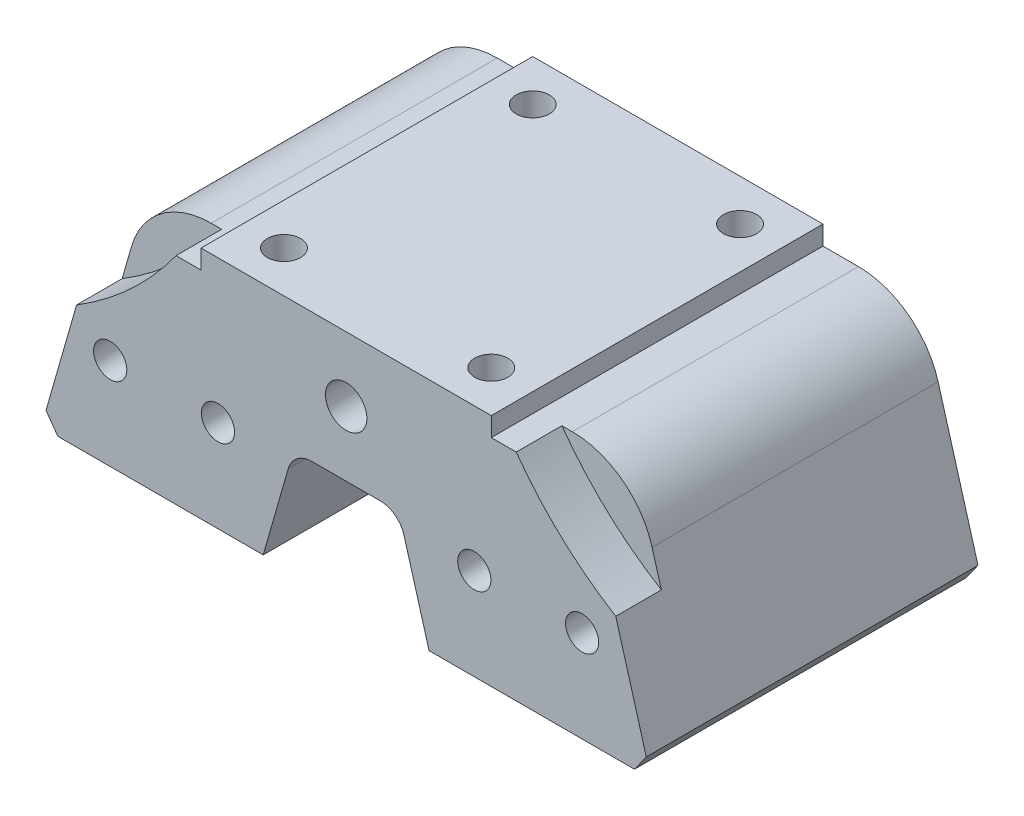
from build123d import *
from build123d.topology import SkipClean

# Parameters (mm, degrees)
SKETCH_1_R              = 2.4
SKETCH_1_R_2            = 6.5
EXTRUDE_1_DEPTH         = 40
FILLET_1_R              = 10
SKETCH_2_R              = 2.4
CUT_EXTRUDE_1_DEPTH     = 66.0828238
SKETCH_4_R              = 41.2
CUT_EXTRUDE_2_DEPTH     = 5.5
CUT_EXTRUDE_3_DEPTH     = 64.25167155
SKETCH_6_W              = 35.436929204
SKETCH_6_H              = 26
EXTRUDE_2_DEPTH         = 40
CUT_EXTRUDE_4_DEPTH     = 42
EXTRUDE_START           = -40
EXTRUDE_3_DEPTH         = 40
SKETCH_9_R              = 2
CUT_EXTRUDE_5_DEPTH     = 42
SKETCH_13_R             = 2
CUT_EXTRUDE_6_DEPTH     = 10
SKETCH_14_R             = 2
EXTRUDE_4_DEPTH         = 40
EXTRUDE_START_2         = 2.3
SKETCH_15_W             = 35
SKETCH_15_H             = 40
SKETCH_15_R             = 2
EXTRUDE_5_DEPTH         = 2.3
SKETCH_16_R             = 2.5
CUT_EXTRUDE_7_DEPTH     = 62.3
CUT_EXTRUDE_START       = -26
CUT_EXTRUDE_8_OUTLINE_R = 2
CUT_EXTRUDE_8_DEPTH     = 19.5


# Read off the part's stored shape, not the designer's step: 切除-拉伸8
with BuildPart() as part:
    # 草图1 → 凸台-拉伸1 (new body)
    with BuildSketch(Plane.XY):
        Polygon((-29.269334238, -5), (44.269334238, -5), (36.813954208, 21), (-21.813954208, 21), align=None)
        with Locations((15, 17)):
            Circle(SKETCH_1_R, mode=Mode.SUBTRACT)
        with Locations((15, 0)):
            Circle(SKETCH_1_R, mode=Mode.SUBTRACT)
        Circle(SKETCH_1_R, mode=Mode.SUBTRACT)
        with Locations((0, 17)):
            Circle(SKETCH_1_R, mode=Mode.SUBTRACT)
        with Locations((7.5, 8)):
            Circle(SKETCH_1_R_2, mode=Mode.SUBTRACT)
    extrude(amount=EXTRUDE_1_DEPTH)

    # 圆角1
    fillet_1_edges = [part.edges().sort_by_distance(p)[0] for p in [
        (-21.813954208, 21, 20),
        (36.813954208, 21, 20),
    ]]
    fillet(fillet_1_edges, radius=FILLET_1_R)

    # 草图2 → 切除-拉伸1 (cut, through all)
    with BuildSketch(Plane(origin=(0, 21, 0), x_dir=(1, 0, 0), z_dir=(0, 1, 0))):
        with Locations(Location((-5, -5, 0), (0, 0, 180))):
            Circle(SKETCH_2_R)
        with Locations(Location((20, -5, 0), (0, 0, 180))):
            Circle(SKETCH_2_R)
        with Locations(Location((-5, -35, 0), (0, 0, 180))):
            Circle(SKETCH_2_R)
        with Locations(Location((20, -35, 0), (0, 0, 180))):
            Circle(SKETCH_2_R)
    extrude(amount=-CUT_EXTRUDE_1_DEPTH, mode=Mode.SUBTRACT)

    # 草图4 → 切除-拉伸2 (cut)
    with BuildSketch(Plane.XY.offset(40)):
        with Locations((-46.5, 45)):
            Circle(SKETCH_4_R)
        with Locations((61.5, 45)):
            Circle(SKETCH_4_R)
    extrude(amount=-CUT_EXTRUDE_2_DEPTH, mode=Mode.SUBTRACT)

    # 草图5 → 切除-拉伸3 (cut, through all)
    with BuildSketch(Plane(origin=(0, 0, 0), x_dir=(-1, 0, 0), z_dir=(0, 0, -1))):
        Polygon((-42.269334238, -5), (-44.269334238, -5), (-43.695843466, -3), align=None)
        Polygon((28.695843466, -3), (27.269334238, -5), (29.269334238, -5), align=None)
    extrude(amount=-CUT_EXTRUDE_3_DEPTH, mode=Mode.SUBTRACT)

    # 草图6 → 凸台-拉伸2 (add)
    with BuildSketch(Plane.XY.offset(40)):
        with Locations((7.60959875, 8)):
            Rectangle(SKETCH_6_W, SKETCH_6_H)
    extrude(amount=-EXTRUDE_2_DEPTH)

    # 草图7 → 切除-拉伸4 (cut)
    with BuildSketch(Plane.XY.offset(40)):
        with BuildLine():
            Line((-22.507387905, -5), (37.507387905, -5))
            Line((37.507387905, -5), (35.643542897, 1.5))
            Line((35.643542897, 1.5), (34.432453611, 5.723570268))
            Line((34.432453611, 5.723570268), (33.76369363, 8.055813487))
            Line((33.76369363, 8.055813487), (32.642829643, 11.964730745))
            ThreePointArc((32.642829643, 11.964730745), (31.384766288, 13.795224285), (29.278413707, 14.5))
            Line((29.278413707, 14.5), (28.012091734, 14.5))
            Line((28.012091734, 14.5), (24.82521302, 14.5))
            Line((24.82521302, 14.5), (-9.82521302, 14.5))
            Line((-9.82521302, 14.5), (-13.012091734, 14.5))
            Line((-13.012091734, 14.5), (-14.278413707, 14.5))
            ThreePointArc((-14.278413707, 14.5), (-16.384766288, 13.795224285), (-17.642829643, 11.964730745))
            Line((-17.642829643, 11.964730745), (-18.76369363, 8.055813487))
            Line((-18.76369363, 8.055813487), (-19.432453611, 5.723570268))
            Line((-19.432453611, 5.723570268), (-20.643542897, 1.5))
            Line((-20.643542897, 1.5), (-22.507387905, -5))
        make_face()
    extrude(amount=-CUT_EXTRUDE_4_DEPTH, mode=Mode.SUBTRACT)

    # 草图8 → 凸台-拉伸3 (add)
    with BuildSketch(Plane(origin=(0, 0, 0), x_dir=(-1, 0, 0), z_dir=(0, 0, -1)).offset(EXTRUDE_START)):
        with BuildLine():
            Line((-32.642829643, 11.964730745), (-36.218494875, -0.505095833))
            ThreePointArc((-36.218494875, -0.505095833), (-31.672508019, 1.693488789), (-29.830249532, 6.395175135))
            ThreePointArc((-29.830249532, 6.395175135), (-30.573281352, 9.514892934), (-32.642829643, 11.964730745))
        make_face()
        with BuildLine():
            ThreePointArc((17.642829643, 11.964730745), (15.098349227, 4.487546685), (21.218494875, -0.505095833))
            Line((21.218494875, -0.505095833), (17.642829643, 11.964730745))
        make_face()
    extrude(amount=EXTRUDE_3_DEPTH)

    # 草图9 → 切除-拉伸5 (cut)
    with BuildSketch(Plane(origin=(0, 0, 0), x_dir=(-1, 0, 0), z_dir=(0, 0, -1))):
        with Locations((-35.953320593, 6.086964229)):
            Circle(SKETCH_9_R)
        with Locations((20.953320593, 6.086964229)):
            Circle(SKETCH_9_R)
    extrude(amount=-CUT_EXTRUDE_5_DEPTH, mode=Mode.SUBTRACT)

    # 草图13 → 切除-拉伸6 (cut)
    with BuildSketch(Plane(origin=(0, 21, 0), x_dir=(1, 0, 0), z_dir=(0, 1, 0))):
        with Locations(Location((20, -35, 0), (0, 0, 180))):
            Circle(SKETCH_13_R)
        with Locations(Location((-5, -35, 0), (0, 0, 180))):
            Circle(SKETCH_13_R)
        with Locations(Location((-5, -5, 0), (0, 0, 180))):
            Circle(SKETCH_13_R)
        with Locations(Location((20, -5, 0), (0, 0, 180))):
            Circle(SKETCH_13_R)
    extrude(amount=-CUT_EXTRUDE_6_DEPTH, mode=Mode.SUBTRACT)

    # 草图14 → 凸台-拉伸4 (add)
    with BuildSketch(Plane(origin=(0, 0, 0), x_dir=(-1, 0, 0), z_dir=(0, 0, -1)).offset(EXTRUDE_START)):
        with BuildLine():
            Line((-36.218494875, -0.505095833), (-37.507387905, -5))
            Line((-37.507387905, -5), (-17.5, -5))
            Line((-17.5, -5), (-14.481456538, 5.526912067))
            ThreePointArc((-14.481456538, 5.526912067), (-13.40311652, 7.09590653), (-11.597671451, 7.7))
            Line((-11.597671451, 7.7), (-7.5, 7.7))
            Line((-7.5, 7.7), (-3.402328549, 7.7))
            ThreePointArc((-3.402328549, 7.7), (-1.59688348, 7.09590653), (-0.518543462, 5.526912067))
            Line((-0.518543462, 5.526912067), (2.5, -5))
            Line((2.5, -5), (22.507387905, -5))
            Line((22.507387905, -5), (21.218494875, -0.505095833))
            ThreePointArc((21.218494875, -0.505095833), (15.098349227, 4.487546685), (17.642829643, 11.964730745))
            ThreePointArc((17.642829643, 11.964730745), (16.384766288, 13.795224285), (14.278413707, 14.5))
            Line((14.278413707, 14.5), (-29.278413707, 14.5))
            ThreePointArc((-29.278413707, 14.5), (-31.384766288, 13.795224285), (-32.642829643, 11.964730745))
            ThreePointArc((-32.642829643, 11.964730745), (-30.098349227, 4.487546685), (-36.218494875, -0.505095833))
        make_face()
        with Locations((-22.953320593, 6.086964229)):
            Circle(SKETCH_14_R, mode=Mode.SUBTRACT)
        with Locations((7.953320593, 6.086964229)):
            Circle(SKETCH_14_R, mode=Mode.SUBTRACT)
    extrude(amount=EXTRUDE_4_DEPTH)

    # 草图15 → 凸台-拉伸5 (add)
    with BuildSketch(Plane(origin=(0, 21, 0), x_dir=(1, 0, 0), z_dir=(0, 1, 0)).offset(EXTRUDE_START_2)):
        with Locations((7.5, -20)):
            Rectangle(SKETCH_15_W, SKETCH_15_H)
        with Locations(Location((-5, -35, 0), (0, 0, 180))):
            Circle(SKETCH_15_R, mode=Mode.SUBTRACT)
        with Locations(Location((20, -35, 0), (0, 0, 180))):
            Circle(SKETCH_15_R, mode=Mode.SUBTRACT)
        with Locations(Location((-5, -5, 0), (0, 0, 180))):
            Circle(SKETCH_15_R, mode=Mode.SUBTRACT)
        with Locations(Location((20, -5, 0), (0, 0, 180))):
            Circle(SKETCH_15_R, mode=Mode.SUBTRACT)
    extrude(amount=-EXTRUDE_5_DEPTH)

    # 草图16 → 切除-拉伸7 (cut)
    with BuildSketch(Plane(origin=(0, 0, 0), x_dir=(-1, 0, 0), z_dir=(0, 0, -1))):
        with Locations((-7.5, 15.5)):
            Circle(SKETCH_16_R)
    extrude(amount=-CUT_EXTRUDE_7_DEPTH, mode=Mode.SUBTRACT)

    # 切除-拉伸8 outline → 切除-拉伸8 (cut)
    with SkipClean():  # the faces are left unmerged after this step: merging them gives an invalid solid
        with BuildSketch(Plane(origin=(0, 21, 0), x_dir=(1, 0, 0), z_dir=(0, 1, 0)).offset(CUT_EXTRUDE_START)):
            with Locations((-5, -5)):
                Circle(CUT_EXTRUDE_8_OUTLINE_R)
            with Locations((-5, -35)):
                Circle(CUT_EXTRUDE_8_OUTLINE_R)
            with Locations((20, -35)):
                Circle(CUT_EXTRUDE_8_OUTLINE_R)
            with Locations((20, -5)):
                Circle(CUT_EXTRUDE_8_OUTLINE_R)
        extrude(amount=CUT_EXTRUDE_8_DEPTH, mode=Mode.SUBTRACT)


solid = part.part
